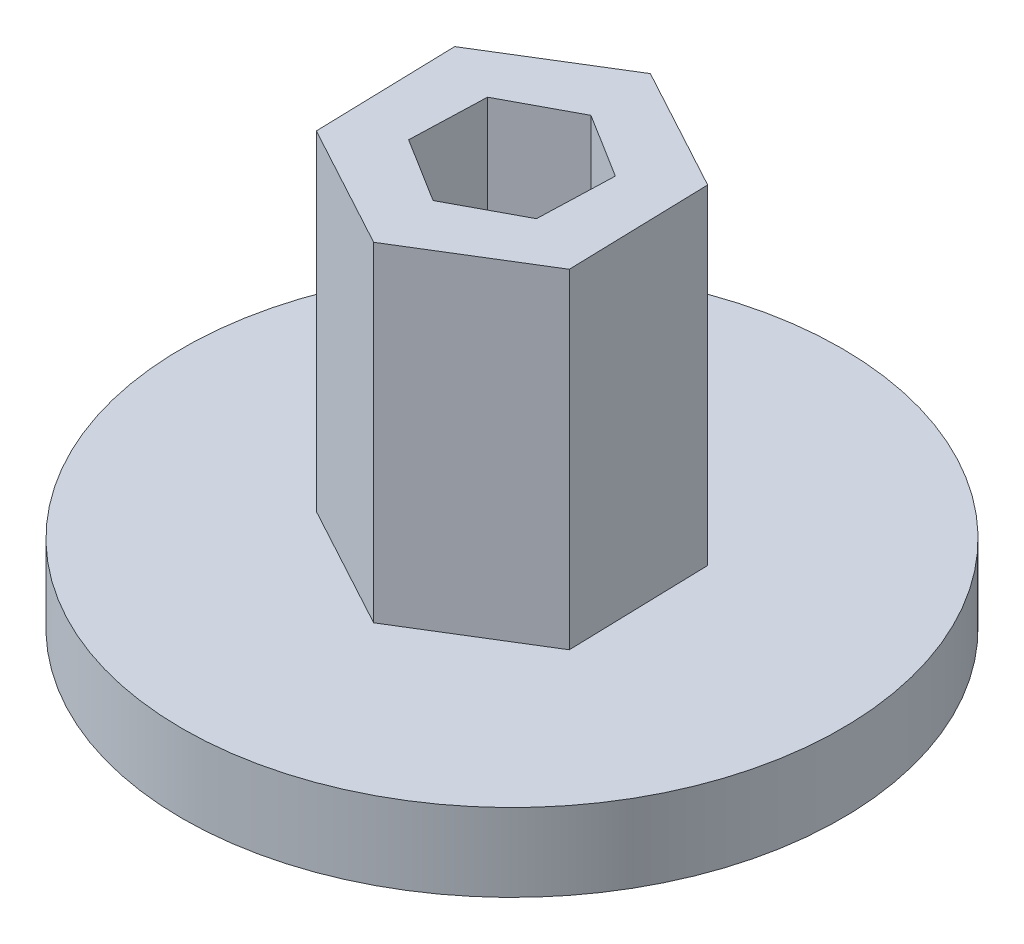
from build123d import *

# Parameters (mm, degrees)
SKETCH1_R           = 12.7
BOSS_EXTRUDE1_DEPTH = 3
BOSS_EXTRUDE2_DEPTH = 12.7
CUT_EXTRUDE1_DEPTH  = 23


with BuildPart() as part:
    # Sketch1 → Boss-Extrude1 (new body)
    with BuildSketch(Plane(origin=(0, 0, 0), x_dir=(1, 0, 0), z_dir=(0, 1, 0))):
        Circle(SKETCH1_R)
    extrude(amount=BOSS_EXTRUDE1_DEPTH)

    # Sketch2 → Boss-Extrude2 (add)
    with BuildSketch(Plane(origin=(0, 3, 0), x_dir=(1, 0, 0), z_dir=(0, 1, 0))):
        Polygon((0.148889151, -5.48), (4.820263788, -2.611058213), (4.671374637, 2.868941787), (-0.148889151, 5.48), (-4.820263788, 2.611058213), (-4.671374637, -2.868941787), align=None)
    extrude(amount=BOSS_EXTRUDE2_DEPTH)

    # Sketch6 → Cut-Extrude1 (cut)
    with BuildSketch(Plane(origin=(0, 15.7, 0), x_dir=(1, 0, 0), z_dir=(0, 1, 0))):
        Polygon((-2.597868549, -1.386029942), (-0.098597134, -2.94283513), (2.499271415, -1.556805188), (2.597868549, 1.386029942), (0.098597134, 2.94283513), (-2.499271415, 1.556805188), align=None)
    extrude(amount=-CUT_EXTRUDE1_DEPTH, mode=Mode.SUBTRACT)


solid = part.part
